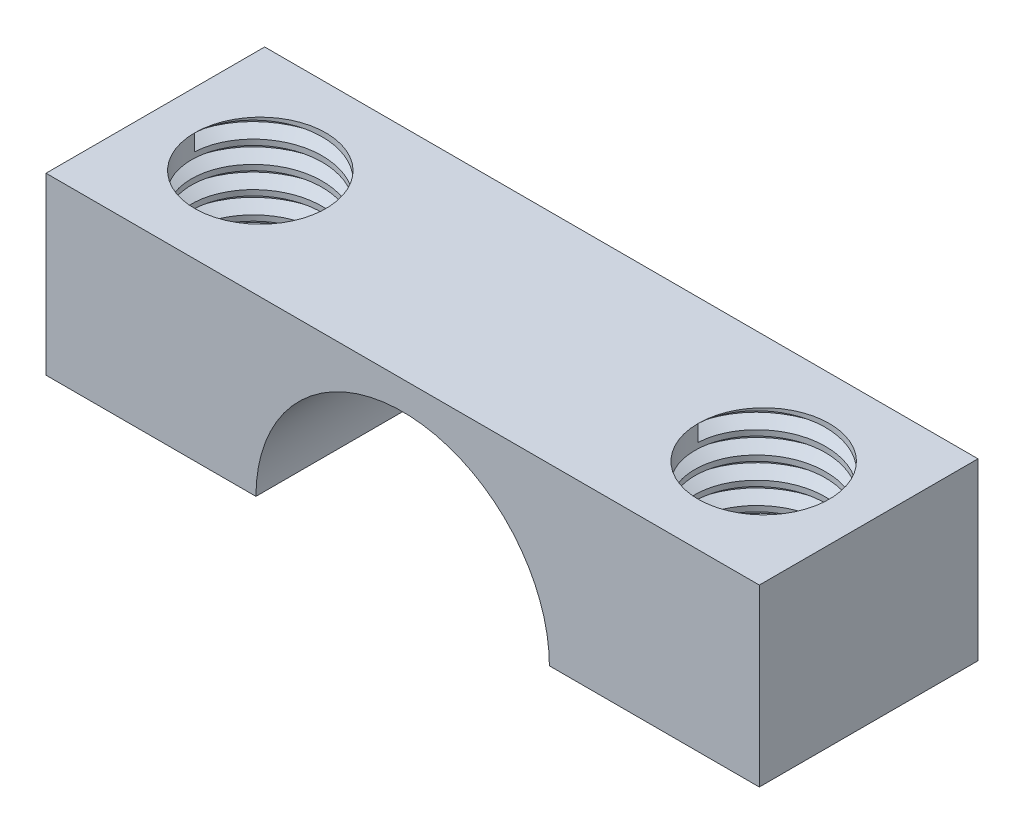
from build123d import *

# Parameters (mm, degrees)
SKETCH1_W                = 16.31
SKETCH1_H                = 4
BOSS_EXTRUDE3_DEPTH      = 5
CUT_EXTRUDE9_DEPTH       = 5
CUT_EXTRUDE10_DEPTH      = 2.5
CUT_EXTRUDE10_DEPTH_BACK = 2.5
SKETCH4_R                = 1.5
THREAD1_PITCH            = 0.5
THREAD2_PITCH            = 0.5


with BuildPart() as part:
    # Sketch1 → Boss-Extrude3 (new body)
    with BuildSketch(Plane.XY):
        Rectangle(SKETCH1_W, SKETCH1_H)
    extrude(amount=-BOSS_EXTRUDE3_DEPTH)

    # Sketch3 → Cut-Extrude9 (cut)
    with BuildSketch(Plane.XY):
        with BuildLine():
            Line((-3.355, -2), (3.355, -2))
            ThreePointArc((3.355, -2), (0, 1.355), (-3.355, -2))
        make_face()
    extrude(amount=-CUT_EXTRUDE9_DEPTH, mode=Mode.SUBTRACT)

    # Sketch4 → Cut-Extrude10 (cut, two sides: drawn at the far end of the back side and taken through both)
    with BuildSketch(Plane(origin=(0, 0, 0), x_dir=(1, 0, 0), z_dir=(0, 1, 0)).offset(-CUT_EXTRUDE10_DEPTH_BACK)):
        with Locations(Location((-5.755, 2.5, 0), (0, 0, 90))):
            Circle(SKETCH4_R)
        with Locations(Location((5.755, 2.5, 0), (0, 0, 90))):
            Circle(SKETCH4_R)
    extrude(amount=CUT_EXTRUDE10_DEPTH + CUT_EXTRUDE10_DEPTH_BACK, mode=Mode.SUBTRACT)

    # Thread1: the profile of Thread Profile1 profile screwed along a right-hand helix of 10 turns, 6 arcs to a turn; built about Z, then put on its axis
    thread1_z = Axis((0, 0, 0), (0, 0, 1))
    thread1_corners = [(1.4997, 0, -0.000173205), (1.770632937, 0, 0.156249999), (1.770632937, 0, 0.218749999), (1.4997, 0, 0.375173204)]
    with BuildLine(mode=Mode.PRIVATE) as thread1_profile:
        Line(thread1_corners[0], thread1_corners[1])
        Line(thread1_corners[1], thread1_corners[2])
        Line(thread1_corners[2], thread1_corners[3])
        Line(thread1_corners[3], thread1_corners[0])
    thread1_cap = Face(thread1_profile.wire())
    thread1_turn_angles = [0, 30, 60, 90, 120, 150, 180, 210, 240, 270, 300, 330, 360]
    thread1_turn_weights = [1, 0.8660254037844387, 1, 0.8660254037844387, 1, 0.8660254037844387, 1, 0.8660254037844387, 1, 0.8660254037844387, 1, 0.8660254037844387, 1]
    thread1_turn_rails = [Edge.make_bspline([Vector(p[0], p[1], 0).rotate(thread1_z, thread1_turn_angles[k]) / thread1_turn_weights[k] + Vector(0, 0, p[2] + THREAD1_PITCH * thread1_turn_angles[k] / 360) for k in range(13)], [0, 0, 0, 1, 1, 2, 2, 3, 3, 4, 4, 5, 5, 6, 6, 6], 2, thread1_turn_weights) for p in thread1_corners]
    thread1_turn_sides = [Face.make_surface_from_curves(thread1_turn_rails[p[0]], thread1_turn_rails[p[1]]) for p in [(0, 1), (1, 2), (2, 3), (3, 0)]]
    thread1 = Plane(origin=(-5.755, 2, -2.5), x_dir=(-1, 0, 0), z_dir=(0, -1, 0)) * Solid(Shell([*[p.moved(Location((0, 0, THREAD1_PITCH * i))) for i in range(10) for p in thread1_turn_sides], thread1_cap, thread1_cap.rotate(thread1_z, 3600).moved(Location((0, 0, THREAD1_PITCH * 3600 / 360)))]))
    add(thread1, mode=Mode.SUBTRACT)

    # Thread2: the profile of Thread Profile2 profile screwed along a right-hand helix of 10 turns, 6 arcs to a turn; built about Z, then put on its axis
    thread2_z = Axis((0, 0, 0), (0, 0, 1))
    thread2_corners = [(1.4997, 0, -0.000173205), (1.770632937, 0, 0.156249999), (1.770632937, 0, 0.218749999), (1.4997, 0, 0.375173204)]
    with BuildLine(mode=Mode.PRIVATE) as thread2_profile:
        Line(thread2_corners[0], thread2_corners[1])
        Line(thread2_corners[1], thread2_corners[2])
        Line(thread2_corners[2], thread2_corners[3])
        Line(thread2_corners[3], thread2_corners[0])
    thread2_cap = Face(thread2_profile.wire())
    thread2_turn_angles = [0, 30, 60, 90, 120, 150, 180, 210, 240, 270, 300, 330, 360]
    thread2_turn_weights = [1, 0.8660254037844387, 1, 0.8660254037844387, 1, 0.8660254037844387, 1, 0.8660254037844387, 1, 0.8660254037844387, 1, 0.8660254037844387, 1]
    thread2_turn_rails = [Edge.make_bspline([Vector(p[0], p[1], 0).rotate(thread2_z, thread2_turn_angles[k]) / thread2_turn_weights[k] + Vector(0, 0, p[2] + THREAD2_PITCH * thread2_turn_angles[k] / 360) for k in range(13)], [0, 0, 0, 1, 1, 2, 2, 3, 3, 4, 4, 5, 5, 6, 6, 6], 2, thread2_turn_weights) for p in thread2_corners]
    thread2_turn_sides = [Face.make_surface_from_curves(thread2_turn_rails[p[0]], thread2_turn_rails[p[1]]) for p in [(0, 1), (1, 2), (2, 3), (3, 0)]]
    thread2 = Plane(origin=(5.755, 2, -2.5), x_dir=(-1, 0, 0), z_dir=(0, -1, 0)) * Solid(Shell([*[p.moved(Location((0, 0, THREAD2_PITCH * i))) for i in range(10) for p in thread2_turn_sides], thread2_cap, thread2_cap.rotate(thread2_z, 3600).moved(Location((0, 0, THREAD2_PITCH * 3600 / 360)))]))
    add(thread2, mode=Mode.SUBTRACT)


solid = part.part
